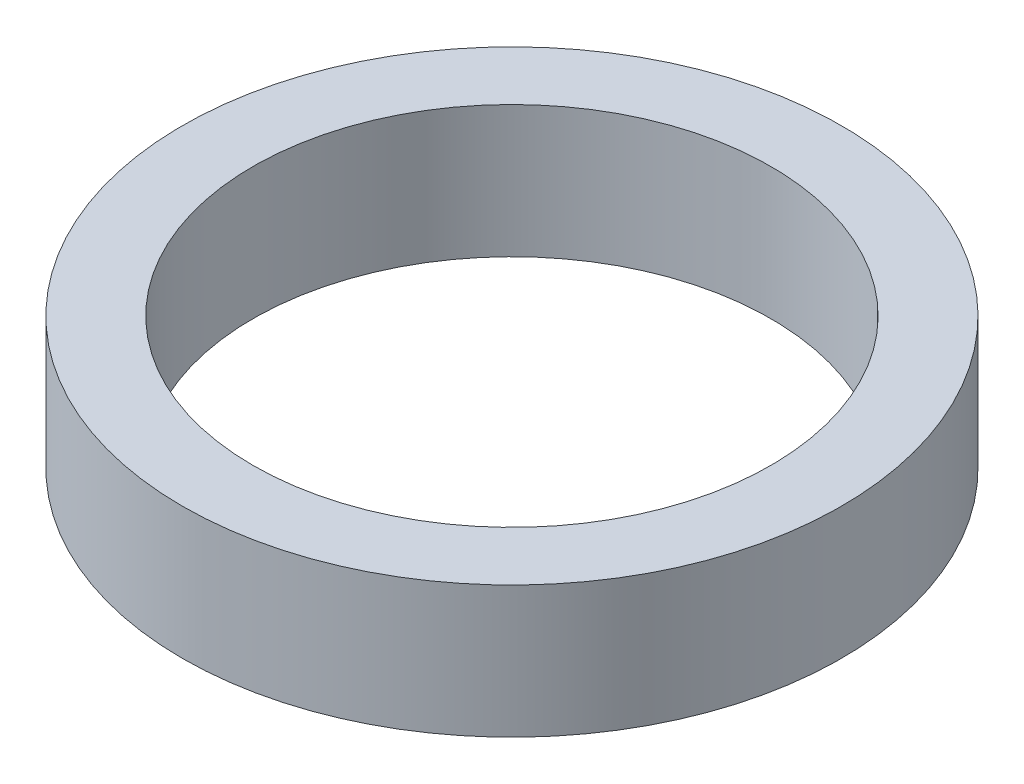
from build123d import *

# Parameters (mm, degrees)
SKETCH1_R           = 35
BOSS_EXTRUDE1_DEPTH = 14
SKETCH2_R           = 27.5
CUT_EXTRUDE1_DEPTH  = 52.439284598


with BuildPart() as part:
    # Sketch1 → Boss-Extrude1 (new body)
    with BuildSketch(Plane(origin=(0, 0, 0), x_dir=(1, 0, 0), z_dir=(0, 1, 0))):
        Circle(SKETCH1_R)
    extrude(amount=BOSS_EXTRUDE1_DEPTH)

    # Sketch2 → Cut-Extrude1 (cut, through all)
    with BuildSketch(Plane(origin=(0, 0, 0), x_dir=(1, 0, 0), z_dir=(0, 1, 0))):
        Circle(SKETCH2_R)
    extrude(amount=CUT_EXTRUDE1_DEPTH, mode=Mode.SUBTRACT)


solid = part.part
